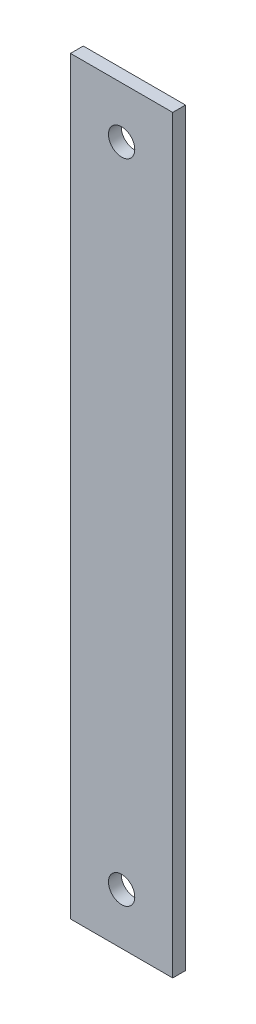
from build123d import *

# Parameters (mm, degrees)
SKETCH1_W                = 38.1
SKETCH1_H                = 279.4
BOSS_EXTRUDE1_DEPTH      = 4.7625
W_0_386_DIAMETER_HOLE1_D = 9.8044


with BuildPart() as part:
    # Sketch1 → Boss-Extrude1 (new body)
    with BuildSketch(Plane.XY):
        with Locations((19.05, 139.7)):
            Rectangle(SKETCH1_W, SKETCH1_H)
    extrude(amount=BOSS_EXTRUDE1_DEPTH)

    # W (0.386) Diameter Hole1 (through all)
    with Locations(Plane.XY.offset(4.7625)):
        with Locations((19.05, 260.35), (19.05, 19.05)):
            Hole(W_0_386_DIAMETER_HOLE1_D / 2)


solid = part.part
